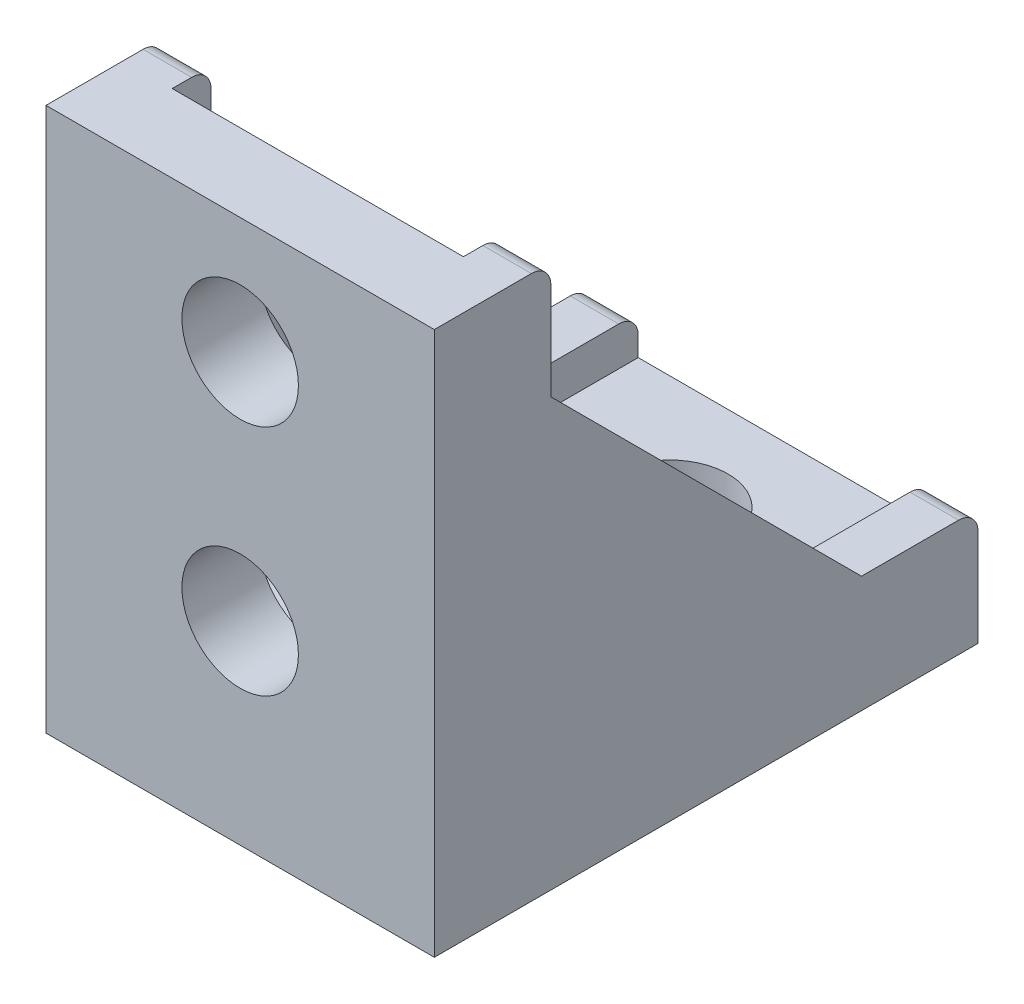
from build123d import *

# Parameters (mm, degrees)
SKETCH1_W               = 17.5
SKETCH1_H               = 16
BOSS_EXTRUDE1_DEPTH     = 6
SKETCH2_W               = 2.5
SKETCH2_H               = 16
BOSS_EXTRUDE2_DEPTH     = 22
BOSS_EXTRUDE3_DEPTH     = 2.5
BOSS_EXTRUDE4_DEPTH     = 6
SKETCH5_W               = 20
SKETCH5_H               = 28
BOSS_EXTRUDE5_DEPTH     = 6
CUT_EXTRUDE1_REACH      = 40.21
SKETCH7_W               = 15
SKETCH7_H               = 22
CUT_EXTRUDE2_REACH      = 40.21
SKETCH9_W               = 15
SKETCH9_H               = 24
CUT_EXTRUDE3_DEPTH      = 45.362146026
CUT_EXTRUDE4_DEPTH      = 39.209946349
CUT_EXTRUDE5_DEPTH      = 41.841155713
BOSS_EXTRUDE6_DEPTH     = 6
BOSS_EXTRUDE7_DEPTH     = 6
BOSS_EXTRUDE8_DEPTH     = 6
BOSS_EXTRUDE9_DEPTH     = 6
FILLET1_R               = 1
SKETCH17_W              = 15
SKETCH17_H              = 24
BOSS_EXTRUDE10_DEPTH    = 4
SKETCH18_W              = 15
SKETCH18_H              = 24
BOSS_EXTRUDE11_DEPTH    = 4
CUT_EXTRUDE6_DEPTH      = 10
CUT_EXTRUDE7_DEPTH      = 10
CUT_EXTRUDE8_DEPTH      = 39.52596527
CUT_EXTRUDE8_DEPTH_BACK = 39.52596527
SKETCH21_W              = 6
SKETCH21_H              = 1.6
CUT_EXTRUDE9_DEPTH      = 39.52596527
CUT_EXTRUDE9_DEPTH_BACK = 39.52596527
SKETCH22_W              = 6
SKETCH22_H              = 1.6


with BuildPart() as part:
    # Sketch1 → Boss-Extrude1 (new body)
    with BuildSketch(Plane.XY):
        with Locations((-1.25, 14)):
            Rectangle(SKETCH1_W, SKETCH1_H)
    extrude(amount=-BOSS_EXTRUDE1_DEPTH)

    # Sketch2 → Boss-Extrude2 (add)
    with BuildSketch(Plane(origin=(0, 0, -6), x_dir=(-1, 0, 0), z_dir=(0, 0, -1))):
        with Locations((8.75, 14)):
            Rectangle(SKETCH2_W, SKETCH2_H)
    extrude(amount=BOSS_EXTRUDE2_DEPTH)

    # Sketch3 → Boss-Extrude3 (add)
    with BuildSketch(Plane(origin=(7.5, 0, 0), x_dir=(0, 0, -1), z_dir=(1, 0, 0))):
        Polygon((6, 22), (22, 6), (0, 6), (0, 22), align=None)
    extrude(amount=BOSS_EXTRUDE3_DEPTH)

    # Sketch4 → Boss-Extrude4 (add)
    with BuildSketch(Plane(origin=(0, 22, 0), x_dir=(-1, 0, 0), z_dir=(0, 1, 0))):
        Polygon((7.5, -6), (-10, -6), (-10, 0), (10, 0), (10, -28), (7.5, -28), align=None)
    extrude(amount=BOSS_EXTRUDE4_DEPTH)

    # Sketch5 → Boss-Extrude5 (add)
    with BuildSketch(Plane.XZ.offset(-6)):
        with Locations((0, -14)):
            Rectangle(SKETCH5_W, SKETCH5_H)
    extrude(amount=BOSS_EXTRUDE5_DEPTH)

    # Sketch7 → Cut-Extrude1 (cut, up to next)
    with BuildSketch(Plane.XY.offset(-4), mode=Mode.PRIVATE) as cut_extrude1_sk1:
        with Locations((0, 17)):
            Rectangle(SKETCH7_W, SKETCH7_H)
    cut_extrude1_tool1 = extrude(cut_extrude1_sk1.sketch, amount=-CUT_EXTRUDE1_REACH, mode=Mode.PRIVATE) & part.part
    add(cut_extrude1_tool1.solids().sort_by_distance((0, 17, -4))[0], mode=Mode.SUBTRACT)

    # Sketch9 → Cut-Extrude2 (cut, up to next)
    with BuildSketch(Plane.XZ.offset(-4), mode=Mode.PRIVATE) as cut_extrude2_sk1:
        with Locations((0, -16)):
            Rectangle(SKETCH9_W, SKETCH9_H)
    cut_extrude2_tool1 = extrude(cut_extrude2_sk1.sketch, amount=-CUT_EXTRUDE2_REACH, mode=Mode.PRIVATE) & part.part
    add(cut_extrude2_tool1.solids().sort_by_distance((0, 4, -16))[0], mode=Mode.SUBTRACT)

    # Sketch10 → Cut-Extrude3 (cut, through all)
    with BuildSketch(Plane.ZY.offset(10)):
        Polygon((-28, 28), (-28, 6), (-22, 6), (-6, 22), (-6, 28), align=None)
    extrude(amount=-CUT_EXTRUDE3_DEPTH, mode=Mode.SUBTRACT)

    # Sketch11 → Cut-Extrude4 (cut, through all)
    with BuildSketch(Plane(origin=(0, 0, -4), x_dir=(-1, 0, 0), z_dir=(0, 0, -1))):
        with BuildLine():
            Line((3.25, 12.5), (3.25, 18))
            ThreePointArc((3.25, 18), (0, 21.25), (-3.25, 18))
            Line((-3.25, 18), (-3.25, 12.5))
            ThreePointArc((-3.25, 12.5), (0, 9.25), (3.25, 12.5))
        make_face()
    extrude(amount=-CUT_EXTRUDE4_DEPTH, mode=Mode.SUBTRACT)

    # Sketch12 → Cut-Extrude5 (cut, through all)
    with BuildSketch(Plane.XZ):
        with BuildLine():
            Line((3.25, -18), (3.25, -12.5))
            ThreePointArc((3.25, -12.5), (0, -9.25), (-3.25, -12.5))
            Line((-3.25, -12.5), (-3.25, -18))
            ThreePointArc((-3.25, -18), (0, -21.25), (3.25, -18))
        make_face()
    extrude(amount=-CUT_EXTRUDE5_DEPTH, mode=Mode.SUBTRACT)

    # Sketch13 → Boss-Extrude6 (add)
    with BuildSketch(Plane(origin=(3, 0, 0), x_dir=(0, 0, -1), z_dir=(1, 0, 0))):
        Polygon((0, 26.5), (-1.6, 24.9), (-1.6, 23.5), (0, 23.5), align=None)
    extrude(amount=-BOSS_EXTRUDE6_DEPTH)

    # Sketch14 → Boss-Extrude7 (add)
    with BuildSketch(Plane(origin=(3, 0, 0), x_dir=(0, 0, -1), z_dir=(1, 0, 0))):
        Polygon((0, 6.5), (-1.6, 4.9), (-1.6, 3.5), (0, 3.5), align=None)
    extrude(amount=-BOSS_EXTRUDE7_DEPTH)

    # Sketch15 → Boss-Extrude8 (add)
    with BuildSketch(Plane(origin=(3, 0, 0), x_dir=(0, 0, -1), z_dir=(1, 0, 0))):
        Polygon((23.5, 0), (23.5, -1.6), (24.9, -1.6), (26.5, 0), align=None)
    extrude(amount=-BOSS_EXTRUDE8_DEPTH)

    # Sketch16 → Boss-Extrude9 (add)
    with BuildSketch(Plane(origin=(3, 0, 0), x_dir=(0, 0, -1), z_dir=(1, 0, 0))):
        Polygon((3.5, 0), (3.5, -1.6), (4.9, -1.6), (6.5, 0), align=None)
    extrude(amount=-BOSS_EXTRUDE9_DEPTH)

    # Fillet1
    fillet1_edges = [part.edges().sort_by_distance(p)[0] for p in [
        (-8.75, 6, -28),
        (8.75, 28, -6),
        (8.75, 6, -28),
        (-8.75, 28, -6),
    ]]
    fillet(fillet1_edges, radius=FILLET1_R)

    # Sketch17 → Boss-Extrude10 (add)
    with BuildSketch(Plane(origin=(0, 4, 0), x_dir=(1, 0, 0), z_dir=(0, 1, 0))):
        with Locations((0, 16)):
            Rectangle(SKETCH17_W, SKETCH17_H)
    extrude(amount=-BOSS_EXTRUDE10_DEPTH)

    # Sketch18 → Boss-Extrude11 (add)
    with BuildSketch(Plane(origin=(0, 0, -4), x_dir=(-1, 0, 0), z_dir=(0, 0, -1))):
        with Locations((0, 16)):
            Rectangle(SKETCH18_W, SKETCH18_H)
    extrude(amount=-BOSS_EXTRUDE11_DEPTH)

    # Sketch20 → Cut-Extrude6 (cut)
    with BuildSketch(Plane(origin=(0, 0, -4), x_dir=(-1, 0, 0), z_dir=(0, 0, -1))):
        with BuildLine():
            ThreePointArc((3, 22), (2.121320344, 24.121320344), (0, 25))
            Line((0, 25), (0, 22))
            Line((0, 22), (0, 19))
            ThreePointArc((0, 19), (2.121320344, 19.878679656), (3, 22))
        make_face()
        with BuildLine():
            Line((0, 22), (0, 25))
            ThreePointArc((0, 25), (-3, 22), (0, 19))
            Line((0, 19), (0, 22))
        make_face()
        with BuildLine():
            ThreePointArc((3, 10), (2.121320344, 12.121320344), (0, 13))
            Line((0, 13), (0, 10))
            Line((0, 10), (0, 7))
            ThreePointArc((0, 7), (2.121320344, 7.878679656), (3, 10))
        make_face()
        with BuildLine():
            Line((0, 10), (0, 13))
            ThreePointArc((0, 13), (-3, 10), (0, 7))
            Line((0, 7), (0, 10))
        make_face()
    extrude(amount=-CUT_EXTRUDE6_DEPTH, mode=Mode.SUBTRACT)

    # Sketch19 → Cut-Extrude7 (cut)
    with BuildSketch(Plane(origin=(0, 4, 0), x_dir=(1, 0, 0), z_dir=(0, 1, 0))):
        with BuildLine():
            Line((0, 19.123546409), (0, 22))
            Line((0, 22), (0, 22.123546409))
            Line((0, 22.123546409), (0, 25.123546409))
            ThreePointArc((0, 25.123546409), (-3, 22.123546409), (0, 19.123546409))
        make_face()
        with BuildLine():
            Line((0, 22.123546409), (0, 22))
            Line((0, 22), (0, 19.123546409))
            ThreePointArc((0, 19.123546409), (2.121320344, 20.002226065), (3, 22.123546409))
            ThreePointArc((3, 22.123546409), (2.121320344, 24.244866752), (0, 25.123546409))
            Line((0, 25.123546409), (0, 22.123546409))
        make_face()
        with BuildLine():
            ThreePointArc((3, 10), (2.121320344, 12.121320344), (0, 13))
            Line((0, 13), (0, 10))
            Line((0, 10), (0, 7))
            ThreePointArc((0, 7), (2.121320344, 7.878679656), (3, 10))
        make_face()
        with BuildLine():
            Line((0, 10), (0, 13))
            ThreePointArc((0, 13), (-3, 10), (0, 7))
            Line((0, 7), (0, 10))
        make_face()
    extrude(amount=-CUT_EXTRUDE7_DEPTH, mode=Mode.SUBTRACT)

    # Sketch21 → Cut-Extrude8 (cut, two sides: drawn at the far end of the back side and taken through both)
    with BuildSketch(Plane.XZ.offset(-3.5).offset(-CUT_EXTRUDE8_DEPTH_BACK)):
        with Locations((0, 0.8)):
            Rectangle(SKETCH21_W, SKETCH21_H)
    extrude(amount=CUT_EXTRUDE8_DEPTH + CUT_EXTRUDE8_DEPTH_BACK, mode=Mode.SUBTRACT)

    # Sketch22 → Cut-Extrude9 (cut, two sides: drawn at the far end of the back side and taken through both)
    with BuildSketch(Plane.XY.offset(-3.5).offset(-CUT_EXTRUDE9_DEPTH_BACK)):
        with Locations((0, -0.8)):
            Rectangle(SKETCH22_W, SKETCH22_H)
    extrude(amount=CUT_EXTRUDE9_DEPTH + CUT_EXTRUDE9_DEPTH_BACK, mode=Mode.SUBTRACT)


solid = part.part
